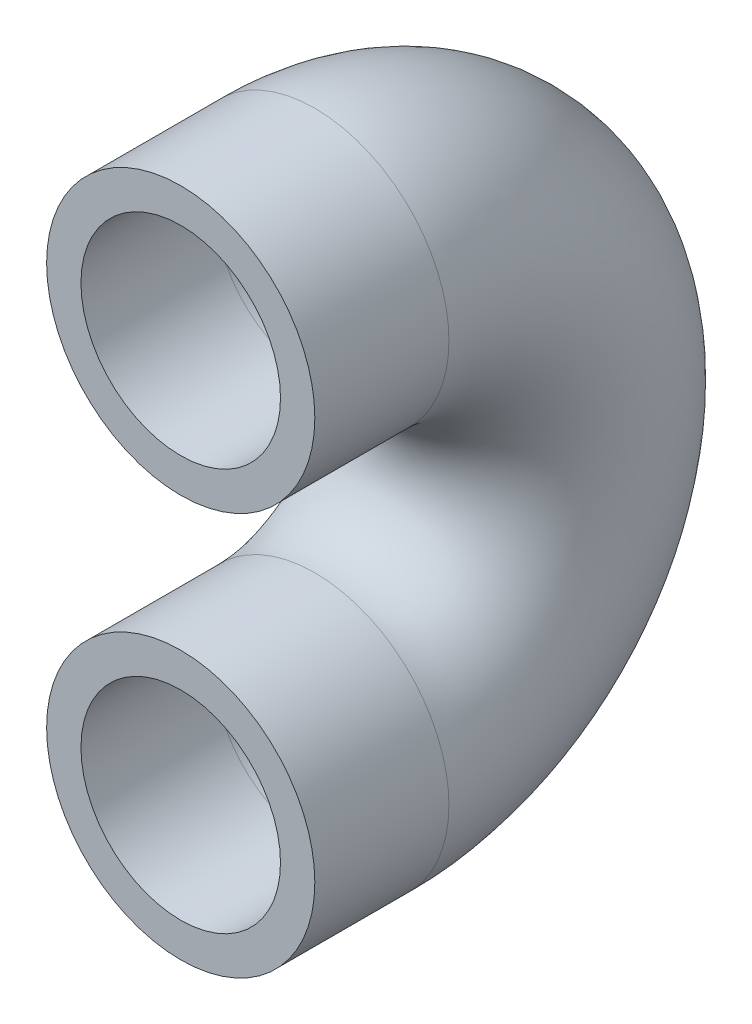
from build123d import *

# Parameters (mm, degrees)
SKETCH1_R             = 3.175
SKETCH1_R_2           = 2.3622
BOSS_EXTRUDE1_DEPTH   = 3.175
BOSS_EXTRUDE1_2_DEPTH = 3.175
SKETCH2_R             = 3.175
SKETCH2_R_2           = 2.3622
REVOLVE1_ANGLE        = 180


with BuildPart() as part:
    # Sketch1 → Boss-Extrude1 (new body)
    with BuildSketch(Plane.XY):
        with Locations((-4.7625, 13.335)):
            Circle(SKETCH1_R)
        with Locations((-4.7625, 13.335)):
            Circle(SKETCH1_R_2, mode=Mode.SUBTRACT)
    extrude(amount=BOSS_EXTRUDE1_DEPTH)



with BuildPart() as body_2:
    # Sketch1 → Boss-Extrude1 2 (new body)
    with BuildSketch(Plane.XY):
        with Locations((-4.7625, 3.81)):
            Circle(SKETCH1_R)
        with Locations((-4.7625, 3.81)):
            Circle(SKETCH1_R_2, mode=Mode.SUBTRACT)
    extrude(amount=BOSS_EXTRUDE1_2_DEPTH)


with BuildPart() as part_1:
    add(part.part)

    add(body_2.part)  # Revolve1 merges body 2
    # Sketch2 → Revolve1 (revolve)
    with BuildSketch(Plane(origin=(0, 0, 0), x_dir=(-1, 0, 0), z_dir=(0, 0, -1))):
        with Locations((4.7625, 13.335)):
            Circle(SKETCH2_R)
        with Locations((4.7625, 13.335)):
            Circle(SKETCH2_R_2, mode=Mode.SUBTRACT)
    revolve(axis=Axis((-4.888279011, 8.5725, 0), (-1, 0, 0)), revolution_arc=REVOLVE1_ANGLE)


solid = part_1.part
